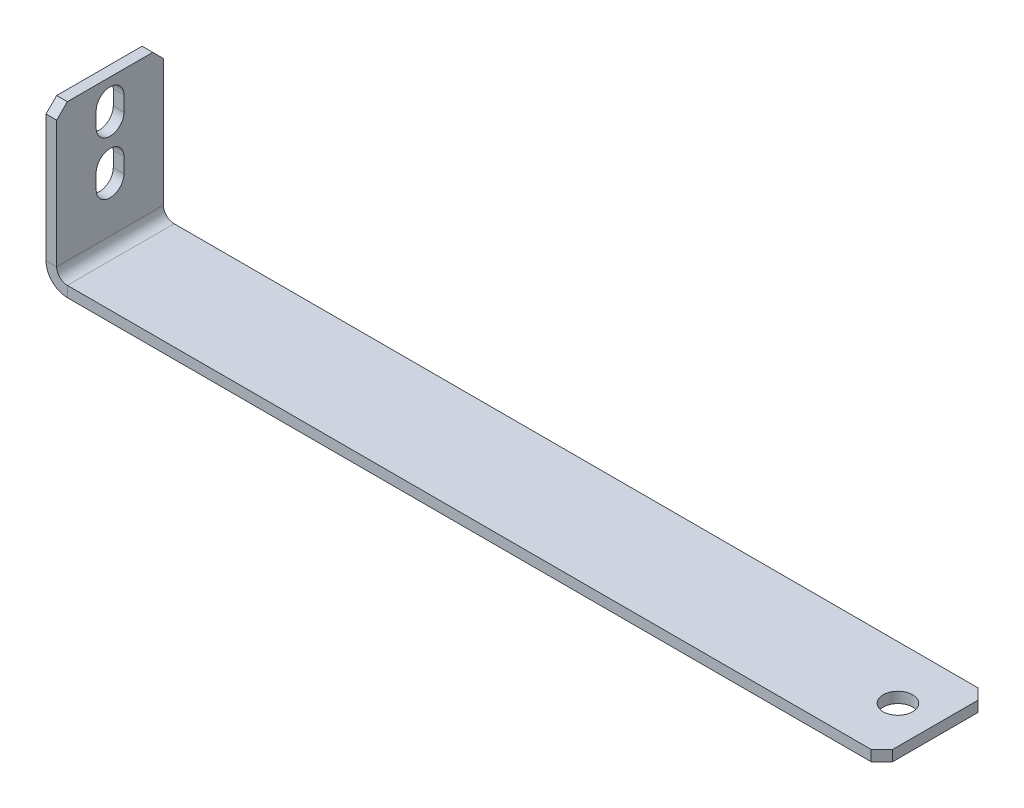
from build123d import *

# Parameters (mm, degrees)
SM_BASE_FLANGE_1_DEPTH = 50
SKETCH_3_R             = 6.9
CUT_EXTRUDE_2_DEPTH    = 10
SKETCH_4_R             = 6.5
CUT_EXTRUDE_3_DEPTH    = 10
OTHER_START            = 49.143921292
OTHER_1_OUTLINE_W      = 8
OTHER_1_OUTLINE_H      = 38
OTHER_1_DEPTH          = 3.535533906
OTHER_START_2          = 84.499260352
OTHER_1_2_OUTLINE_W    = 8
OTHER_1_2_OUTLINE_H    = 10
OTHER_1_2_DEPTH        = 3.535533906
OTHER_START_3          = -3.535533906
OTHER_1_3_OUTLINE_W    = 10
OTHER_1_3_OUTLINE_H    = 7
OTHER_1_3_DEPTH        = 3.535533906
OTHER_START_4          = 31.819805153
OTHER_1_4_OUTLINE_W    = 38
OTHER_1_4_OUTLINE_H    = 7
OTHER_1_4_DEPTH        = 3.535533906


# Read off the part's stored shape, not the designer's step: Затупленный угол1
# Sheet-metal steps are written as plain solids
with BuildPart() as part:
    # Sketch 1 → Базовая кромка1 (new body)
    with BuildSketch(Plane.XY):
        with BuildLine():
            Line((-391.45, 74.5), (-391.45, 10))
            ThreePointArc((-391.45, 10), (-388.521067812, 2.928932188), (-381.45, 0))
            Line((-381.45, 0), (0, 0))
            Line((0, 0), (0, 5))
            Line((0, 5), (-381.45, 5))
            ThreePointArc((-381.45, 5), (-384.985533906, 6.464466094), (-386.45, 10))
            Line((-386.45, 10), (-386.45, 74.5))
            Line((-386.45, 74.5), (-391.45, 74.5))
        make_face()
    extrude(amount=SM_BASE_FLANGE_1_DEPTH)

    # Эскиз3 → Вырез-Вытянуть2 (cut)
    with BuildSketch(Plane(origin=(0, 5, 0), x_dir=(1, 0, 0), z_dir=(0, 1, 0))):
        with Locations(Location((-17.5, -25, 0), (0, 0, 270))):
            Circle(SKETCH_3_R)
    extrude(amount=-CUT_EXTRUDE_2_DEPTH, mode=Mode.SUBTRACT)

    # Эскиз4 → Вырез-Вытянуть3 (cut)
    with BuildSketch(Plane.ZY.offset(391.45)):
        with BuildLine():
            Line((31.5, 32), (31.5, 35.5))
            ThreePointArc((31.5, 35.5), (25, 29), (18.5, 35.5))
            Line((18.5, 35.5), (18.5, 32))
            ThreePointArc((18.5, 32), (25, 25.5), (31.5, 32))
        make_face()
        with Locations((25, 35.5)):
            Circle(SKETCH_4_R)
        with BuildLine():
            Line((31.5, 35.5), (31.5, 39))
            ThreePointArc((31.5, 39), (25, 45.5), (18.5, 39))
            Line((18.5, 39), (18.5, 35.5))
            ThreePointArc((18.5, 35.5), (25, 42), (31.5, 35.5))
        make_face()
        with BuildLine():
            Line((31.5, 57), (31.5, 60.5))
            ThreePointArc((31.5, 60.5), (25, 54), (18.5, 60.5))
            Line((18.5, 60.5), (18.5, 57))
            ThreePointArc((18.5, 57), (25, 50.5), (31.5, 57))
        make_face()
        with Locations((25, 60.5)):
            Circle(SKETCH_4_R)
        with BuildLine():
            Line((31.5, 60.5), (31.5, 64))
            ThreePointArc((31.5, 64), (25, 70.5), (18.5, 64))
            Line((18.5, 64), (18.5, 60.5))
            ThreePointArc((18.5, 60.5), (25, 67), (31.5, 60.5))
        make_face()
    extrude(amount=-CUT_EXTRUDE_3_DEPTH, mode=Mode.SUBTRACT)

    # Other 1 outline → Other 1 (cut)
    with BuildSketch(Plane(origin=(0, 0, 0), x_dir=(1, 0, 0), z_dir=(0, 0.7071067811865476, -0.7071067811865476)).offset(OTHER_START)):
        with Locations((-389, -67)):
            Rectangle(OTHER_1_OUTLINE_W, OTHER_1_OUTLINE_H)
    extrude(amount=OTHER_1_DEPTH, mode=Mode.SUBTRACT)

    # Other 1 2 outline → Other 1 2 (cut)
    with BuildSketch(Plane(origin=(0, 0, 0), x_dir=(1, 0, 0), z_dir=(0, 0.7071067811865476, 0.7071067811865476)).offset(OTHER_START_2)):
        with Locations((-389, 17)):
            Rectangle(OTHER_1_2_OUTLINE_W, OTHER_1_2_OUTLINE_H)
    extrude(amount=OTHER_1_2_DEPTH, mode=Mode.SUBTRACT)

    # Other 1 3 outline → Other 1 3 (cut)
    with BuildSketch(Plane(origin=(0, 0, 0), x_dir=(0.707106781186549, 0, 0.707106781186546), z_dir=(0.707106781186546, 0, -0.707106781186549)).offset(OTHER_START_3)):
        with Locations((0, -2.5)):
            Rectangle(OTHER_1_3_OUTLINE_W, OTHER_1_3_OUTLINE_H)
    extrude(amount=OTHER_1_3_DEPTH, mode=Mode.SUBTRACT)

    # Other 1 4 outline → Other 1 4 (cut)
    with BuildSketch(Plane(origin=(0, 0, 0), x_dir=(0.707106781186549, 0, -0.707106781186546), z_dir=(0.707106781186546, 0, 0.707106781186549)).offset(OTHER_START_4)):
        with Locations((-21, 2.5)):
            Rectangle(OTHER_1_4_OUTLINE_W, OTHER_1_4_OUTLINE_H)
    extrude(amount=OTHER_1_4_DEPTH, mode=Mode.SUBTRACT)


solid = part.part
